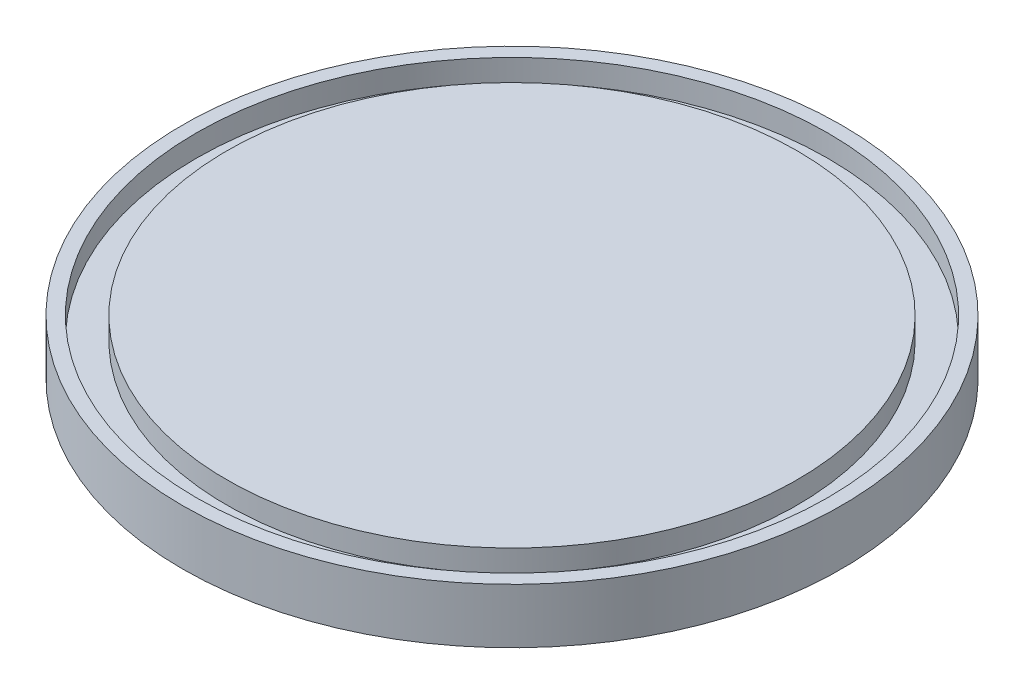
from build123d import *


with BuildPart() as part:
    # Sketch1 → Revolve1 (revolve)
    with BuildSketch(Plane.XY):
        Polygon((-32.9565, 6.35), (-32.9565, 3.81), (-36.5125, 3.81), (-36.5125, 6.35), (-38.1, 6.35), (-38.1, 0), (0, 0), (0, 6.35), align=None)
    revolve(axis=Axis((0, 0, 0), (0, 1, 0)))


solid = part.part
